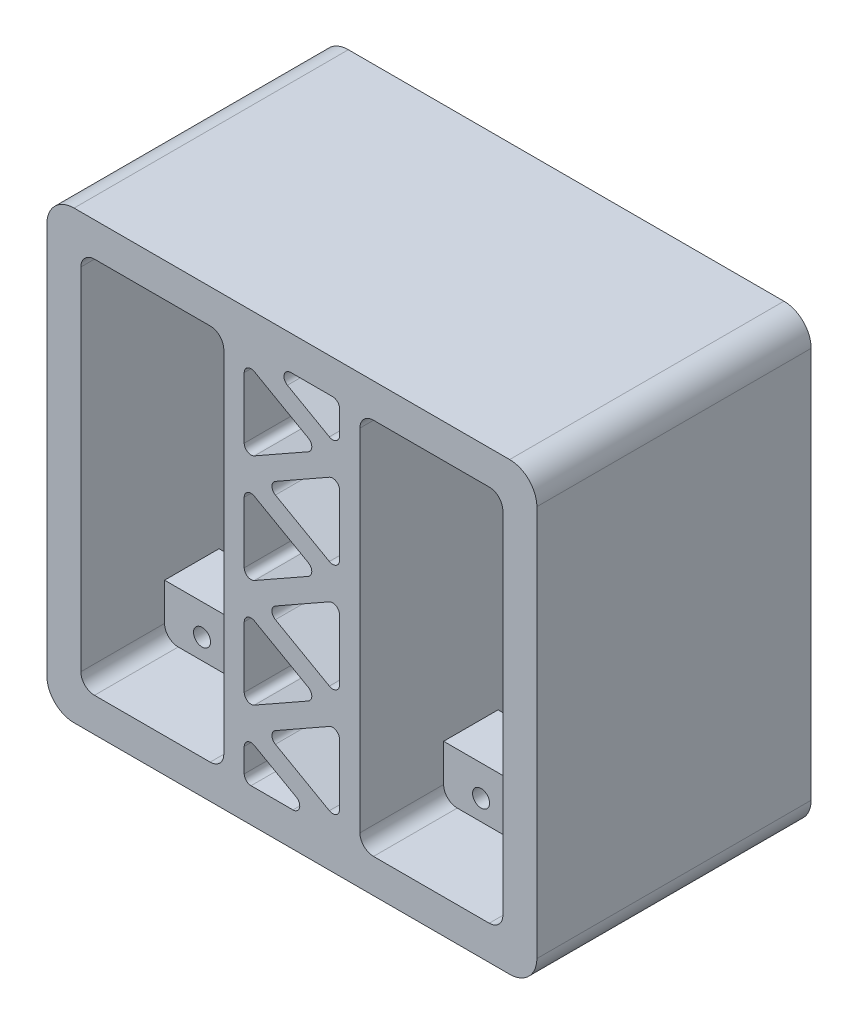
from build123d import *

# Parameters (mm, degrees)
SKETCH1_W           = 72
SKETCH1_H           = 65.5
SKETCH1_W_2         = 21
SKETCH1_H_2         = 40.5
BOSS_EXTRUDE2_DEPTH = 28
SKETCH1_4_W         = 72
SKETCH1_4_H         = 65.5
BOSS_EXTRUDE4_DEPTH = 12.3
FILLET2_R           = 4
FILLET3_R           = 2
SKETCH1_5_R         = 1.25
CUT_EXTRUDE1_DEPTH  = 12
CUT_EXTRUDE2_DEPTH  = 106.348659223
FILLET4_R           = 1
SKETCH8_W           = 21
SKETCH8_H           = 20
CUT_EXTRUDE8_DEPTH  = 10
BOSS_EXTRUDE5_DEPTH = 1.5
BOSS_EXTRUDE6_DEPTH = 1.5


with BuildPart() as part:
    # Sketch1 → Boss-Extrude2 (new body)
    with BuildSketch(Plane.XY):
        with Locations((36, 32.75)):
            Rectangle(SKETCH1_W, SKETCH1_H)
        with Locations((15.5, 32.75)):
            Rectangle(SKETCH1_W_2, SKETCH1_H_2, mode=Mode.SUBTRACT)
        with Locations((56.5, 32.75)):
            Rectangle(SKETCH1_W_2, SKETCH1_H_2, mode=Mode.SUBTRACT)
    extrude(amount=-BOSS_EXTRUDE2_DEPTH)

    # Sketch1<4> → Boss-Extrude4 (add)
    with BuildSketch(Plane.XY):
        with Locations((36, 32.75)):
            Rectangle(SKETCH1_4_W, SKETCH1_4_H)
        Polygon((5, 53), (5, 60.5), (26, 60.5), (26, 53), (26, 12.5), (26, 5), (5, 5), (5, 12.5), align=None, mode=Mode.SUBTRACT)
        Polygon((46, 53), (46, 60.5), (67, 60.5), (67, 53), (67, 12.5), (67, 5), (46, 5), (46, 12.5), align=None, mode=Mode.SUBTRACT)
    extrude(amount=BOSS_EXTRUDE4_DEPTH)

    # Fillet2
    fillet2_edges = [part.edges().sort_by_distance(p)[0] for p in [
        (0, 0, -7.85),
        (72, 0, -7.85),
        (72, 65.5, -7.85),
        (0, 65.5, -7.85),
    ]]
    fillet(fillet2_edges, radius=FILLET2_R)

    # Fillet3
    fillet3_edges = [part.edges().sort_by_distance(p)[0] for p in [
        (46, 60.5, 6.15),
        (67, 5, 6.15),
        (67, 60.5, 6.15),
        (46, 5, 6.15),
        (5, 5, 6.15),
        (26, 5, 6.15),
        (26, 60.5, 6.15),
        (5, 60.5, 6.15),
    ]]
    fillet(fillet3_edges, radius=FILLET3_R)

    # Sketch1<5> → Cut-Extrude1 (cut)
    with BuildSketch(Plane.XY):
        with Locations((10.5, 57.5)):
            Circle(SKETCH1_5_R)
        with Locations((20.5, 57.5)):
            Circle(SKETCH1_5_R)
        with Locations((10.5, 8)):
            Circle(SKETCH1_5_R)
        with Locations((20.5, 8)):
            Circle(SKETCH1_5_R)
        with Locations((51.5, 57.5)):
            Circle(SKETCH1_5_R)
        with Locations((61.5, 57.5)):
            Circle(SKETCH1_5_R)
        with Locations((61.5, 8)):
            Circle(SKETCH1_5_R)
        with Locations((51.5, 8)):
            Circle(SKETCH1_5_R)
    extrude(amount=-CUT_EXTRUDE1_DEPTH, mode=Mode.SUBTRACT)

    # Sketch5 → Cut-Extrude2 (cut, through all)
    with BuildSketch(Plane.XY.offset(12.3)):
        Polygon((39.956097954, 52.571428571), (29, 58.776157515), (29, 46.366699628), align=None)
        Polygon((43, 60.5), (32.043902046, 60.5), (43, 54.295271057), align=None)
        Polygon((39.956097954, 36.714285714), (29, 42.919014658), (29, 30.509556771), align=None)
        Polygon((43, 38.438128199), (43, 50.847586086), (32.043902046, 44.642857143), align=None)
        Polygon((43, 22.580985342), (43, 34.990443229), (32.043902046, 28.785714286), align=None)
        Polygon((39.956097954, 20.857142857), (29, 27.061871801), (29, 14.652413914), align=None)
        Polygon((43, 6.723842485), (43, 19.133300372), (32.043902046, 12.928571429), align=None)
        Polygon((39.956097954, 5), (29, 11.204728943), (29, 5), align=None)
    extrude(amount=-CUT_EXTRUDE2_DEPTH, mode=Mode.SUBTRACT)

    # Fillet4
    fillet4_edges = [part.edges().sort_by_distance(p)[0] for p in [
        (39.956097954, 5, -7.85),
        (29, 11.204728943, -7.85),
        (29, 5, -7.85),
        (43, 6.723842485, -7.85),
        (43, 19.133300372, -7.85),
        (32.043902046, 12.928571429, -7.85),
        (29, 14.652413914, -7.85),
        (29, 27.061871801, -7.85),
        (39.956097954, 20.857142857, -7.85),
        (43, 22.580985342, -7.85),
        (43, 34.990443229, -7.85),
        (32.043902046, 28.785714286, -7.85),
        (39.956097954, 36.714285714, -7.85),
        (29, 30.509556771, -7.85),
        (29, 42.919014658, -7.85),
        (43, 38.438128199, -7.85),
        (32.043902046, 44.642857143, -7.85),
        (43, 50.847586086, -7.85),
        (29, 46.366699628, -7.85),
        (39.956097954, 52.571428571, -7.85),
        (29, 58.776157515, -7.85),
        (43, 54.295271057, -7.85),
        (43, 60.5, -7.85),
        (32.043902046, 60.5, -7.85),
    ]]
    fillet(fillet4_edges, radius=FILLET4_R)

    # Sketch8 → Cut-Extrude8 (cut)
    with BuildSketch(Plane(origin=(0, 12.5, 0), x_dir=(1, 0, 0), z_dir=(0, 1, 0))):
        with Locations((15.5, 18)):
            Rectangle(SKETCH8_W, SKETCH8_H)
        with Locations((56.5, 18)):
            Rectangle(SKETCH8_W, SKETCH8_H)
    cut_extrude8 = extrude(amount=-CUT_EXTRUDE8_DEPTH, mode=Mode.SUBTRACT)

    # Sketch10 → Boss-Extrude5 (add, symmetric)
    with BuildSketch(Plane(origin=(56.5, 0, 0), x_dir=(0, 0, -1), z_dir=(1, 0, 0))):
        Polygon((8, 2.5), (18, 2.5), (8, 12.5), align=None)
    boss_extrude5 = extrude(amount=BOSS_EXTRUDE5_DEPTH, both=True)

    # Sketch11 → Boss-Extrude6 (add, symmetric)
    with BuildSketch(Plane(origin=(15.5, 0, 0), x_dir=(0, 0, -1), z_dir=(1, 0, 0))):
        Polygon((8, 2.5), (18, 2.5), (8, 12.5), align=None)
    boss_extrude6 = extrude(amount=BOSS_EXTRUDE6_DEPTH, both=True)

    # Mirror2: Cut-Extrude8, Boss-Extrude5, Boss-Extrude6 across plane
    add(cut_extrude8.mirror(Plane.ZX.offset(32.75)), mode=Mode.SUBTRACT)
    add(boss_extrude5.mirror(Plane.ZX.offset(32.75)))
    add(boss_extrude6.mirror(Plane.ZX.offset(32.75)))


solid = part.part
